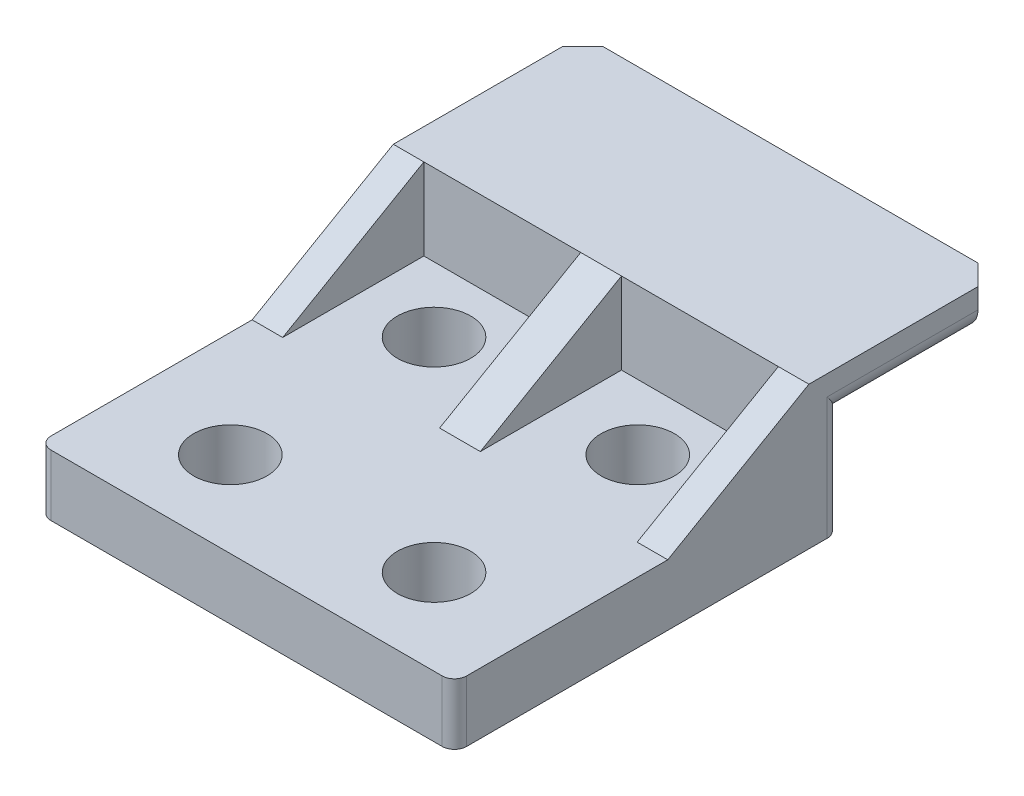
from build123d import *

# Parameters (mm, degrees)
SKETCH1_W                = 20.4
SKETCH1_H                = 18.9
BOSS_EXTRUDE1_DEPTH      = 3
M3_CLEARANCE_HOLE1_D     = 3.6
SKETCH4_W                = 20.4
SKETCH4_H                = 2.4
BOSS_EXTRUDE2_DEPTH      = 1.5
BOSS_EXTRUDE3_DEPTH      = 4
BOSS_EXTRUDE3_DEPTH_BACK = 0.1
SKETCH5_W                = 20.4
SKETCH5_H                = 9.3
CHAMFER1_SIZE            = 3.6
CHAMFER1_SIZE2           = 2.6
FILLET2_R                = 1
CHAMFER3_SIZE            = 1
FILLET1_R                = 0.6
RIB1_REACH               = 31.427
SKETCH7_WALL_W           = 68.853377202
SKETCH7_WALL_H           = 2
RIB2_START               = -1.5
RIB2_DEPTH               = 1.5
RIB10_REACH              = 36.323
SKETCH9_WALL_W           = 78.645466102
SKETCH9_WALL_H           = 1.5


# Read off the part's stored shape, not the designer's step: Rib2
with BuildPart() as part:
    # Sketch1 → Boss-Extrude1 (new body)
    with BuildSketch(Plane(origin=(0, 0, 0), x_dir=(1, 0, 0), z_dir=(0, 1, 0))):
        with Locations((10.2, 9.45)):
            Rectangle(SKETCH1_W, SKETCH1_H)
    extrude(amount=BOSS_EXTRUDE1_DEPTH)

    # M3 Clearance Hole1 (through all)
    with Locations(Plane(origin=(0, 3, 0), x_dir=(1, 0, 0), z_dir=(0, 1, 0))):
        with Locations((5.2, 4.2), (5.2, 14.2), (15.2, 14.2), (15.2, 4.2)):
            Hole(M3_CLEARANCE_HOLE1_D / 2)

    # Sketch4 → Boss-Extrude2 (add)
    with BuildSketch(Plane(origin=(0, 0, -18.9), x_dir=(-1, 0, 0), z_dir=(0, 0, -1))):
        with Locations((-10.2, 1.2)):
            Rectangle(SKETCH4_W, SKETCH4_H)
    extrude(amount=-BOSS_EXTRUDE2_DEPTH)

    # Sketch5 → Boss-Extrude3 (add, two sides: drawn at the far end of the back side and taken through both)
    with BuildSketch(Plane(origin=(0, 3, 0), x_dir=(1, 0, 0), z_dir=(0, 1, 0)).offset(-BOSS_EXTRUDE3_DEPTH_BACK)):
        with Locations((10.2, 22.05)):
            Rectangle(SKETCH5_W, SKETCH5_H)
    extrude(amount=BOSS_EXTRUDE3_DEPTH + BOSS_EXTRUDE3_DEPTH_BACK)

    # Chamfer1
    chamfer1_edges = [part.edges().sort_by_distance(p)[0] for p in [
        (20.4, 2.9, -22.8),
        (0, 2.9, -22.8),
    ]]
    chamfer1_side = [part.faces().sort_by_distance(p)[0] for p in [
        (10.2, 2.9, -22.8),
    ]]
    chamfer(chamfer1_edges, length=CHAMFER1_SIZE, length2=CHAMFER1_SIZE2, reference=chamfer1_side[0])

    # Fillet2
    fillet2_edges = [part.edges().sort_by_distance(p)[0] for p in [
        (20.4, 5.5, -22.8),
        (3.6, 2.9, -22.8),
        (16.8, 2.9, -22.8),
        (0, 5.5, -22.8),
    ]]
    fillet(fillet2_edges, radius=FILLET2_R)

    # Chamfer3
    chamfer3_edges = [part.edges().sort_by_distance(p)[0] for p in [
        (16.784315179, 2.94850664, -26.7),
        (20.290362441, 5.556058922, -26.7),
        (20.4, 6.505655648, -26.7),
        (18.523813503, 4.144976419, -26.7),
        (10.2, 2.9, -26.7),
        (1.876186497, 4.144976419, -26.7),
        (0, 6.505655648, -26.7),
        (0.109637559, 5.556058922, -26.7),
        (3.615684821, 2.94850664, -26.7),
    ]]
    chamfer(chamfer3_edges, length=CHAMFER3_SIZE - 0.0001)  # a hair under: the kernel refuses the full size

    # Fillet1
    fillet1_edges = [part.edges().sort_by_distance(p)[0] for p in [
        (0, 1.5, 0),
        (20.4, 1.5, 0),
        (20.4, 3.005655648, -18.9),
        (0, 3.005655648, -18.9),
    ]]
    fillet(fillet1_edges, radius=FILLET1_R)

    # Sketch7 wall → Rib1 (add, up to next)
    with BuildSketch(Plane(origin=(10.2, 5, -13.935898385), x_dir=(0, -0.500000000015, 0.866025403776), z_dir=(0, 0.866025403776, 0.500000000015)), mode=Mode.PRIVATE) as rib1_sk1:
        Rectangle(SKETCH7_WALL_W, SKETCH7_WALL_H)
    rib1_tool1 = extrude(rib1_sk1.sketch, amount=-RIB1_REACH, mode=Mode.PRIVATE) - part.part
    add(rib1_tool1.solids().sort_by_distance((10.2, 5, -13.935898385))[0])

    # Rib2 outline → Rib2 (add)
    with BuildSketch(Plane.ZY.offset(RIB2_START)):
        Polygon((-10.47179677, 3), (-17.4, 7), (-17.4, 3), align=None)
    extrude(amount=RIB2_DEPTH)

    # Sketch9 wall → Rib10 (add, up to next)
    with BuildSketch(Plane(origin=(20.4, 5, -13.935898385), x_dir=(0, -0.500000000015, 0.866025403776), z_dir=(0, -0.866025403776, -0.500000000015)), mode=Mode.PRIVATE) as rib10_sk1:
        with Locations((0, 0.75)):
            Rectangle(SKETCH9_WALL_W, SKETCH9_WALL_H)
    rib10_tool1 = extrude(rib10_sk1.sketch, amount=RIB10_REACH, mode=Mode.PRIVATE) - part.part
    add(rib10_tool1.solids().sort_by_distance((20.4, 5, -13.935898385))[0])


solid = part.part
